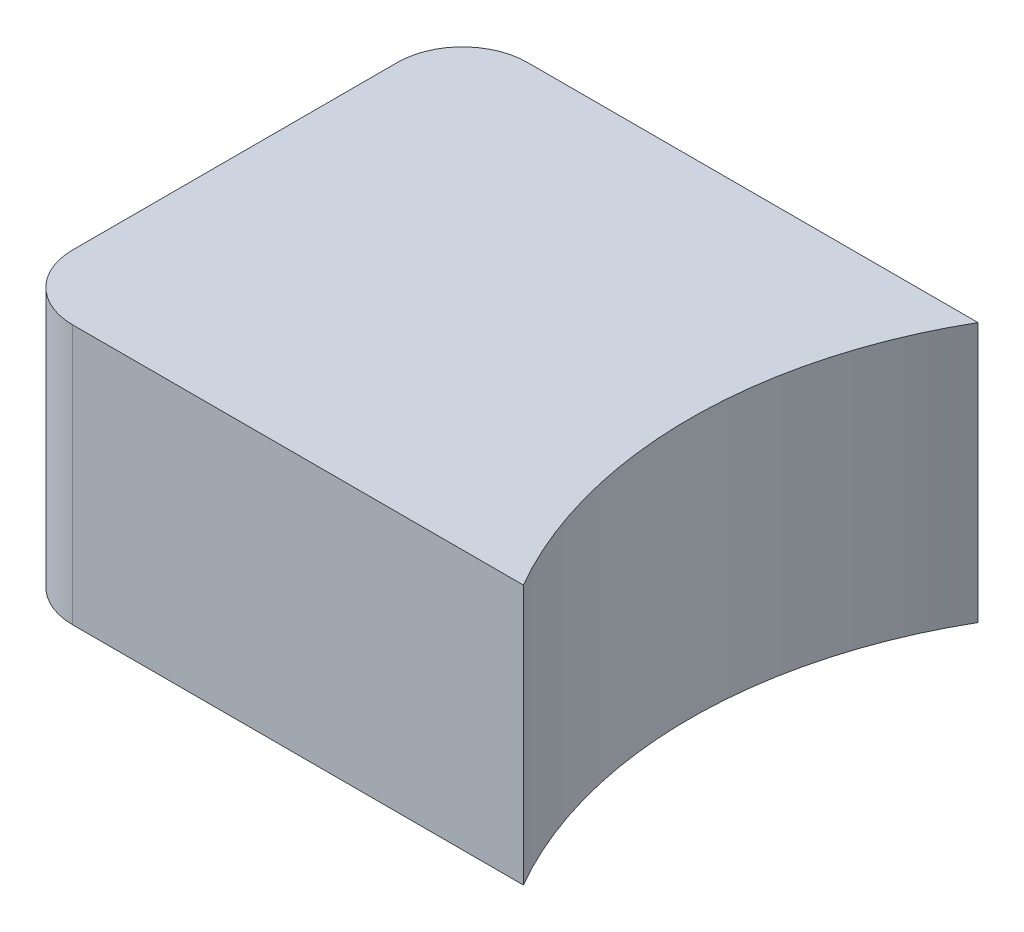
from build123d import *

# Parameters (mm, degrees)
BOSS_EXTRUDE1_START = -10
BOSS_EXTRUDE1_DEPTH = 4
FILLET1_R           = 1
SKETCH3_R           = 3
CUT_EXTRUDE1_DEPTH  = 1.5
CHAMFER1_SIZE       = 0.3


with BuildPart() as part:
    # Sketch2 → Boss-Extrude1 (new body)
    with BuildSketch(Plane(origin=(0, 0, 0), x_dir=(1, 0, 0), z_dir=(0, 1, 0)).offset(BOSS_EXTRUDE1_START)):
        with BuildLine():
            Line((-14, -3.5), (-6.062177826, -3.5))
            ThreePointArc((-6.062177826, -3.5), (-7, 0), (-6.062177826, 3.5))
            Line((-6.062177826, 3.5), (-14, 3.5))
            Line((-14, 3.5), (-14, -3.5))
        make_face()
    extrude(amount=BOSS_EXTRUDE1_DEPTH)

    # Fillet1
    fillet1_edges = [part.edges().sort_by_distance(p)[0] for p in [
        (-14, -8, 3.5),
        (-14, -8, -3.5),
    ]]
    fillet(fillet1_edges, radius=FILLET1_R)

    # Sketch3 → Cut-Extrude1 (cut)
    with BuildSketch(Plane.XZ.offset(10)):
        with Locations((-10.5, 0)):
            Circle(SKETCH3_R)
    extrude(amount=-CUT_EXTRUDE1_DEPTH, mode=Mode.SUBTRACT)

    # Chamfer1
    chamfer1_edges = [part.edges().sort_by_distance(p)[0] for p in [
        (-13.5, -10, 0),
    ]]
    chamfer(chamfer1_edges, length=CHAMFER1_SIZE)


solid = part.part
